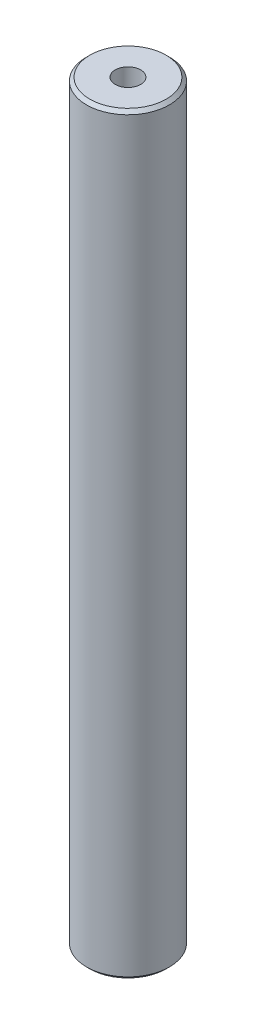
from build123d import *
from OCP.BRepFilletAPI import BRepFilletAPI_MakeChamfer

# Parameters (mm, degrees)
SKETCH1_R           = 32.5
BOSS_EXTRUDE1_DEPTH = 590.439226282
SKETCH2_R           = 9.954082652
CUT_EXTRUDE1_DEPTH  = 593.22544688
CHAMFER1_SIZE       = 2.584361648
CHAMFER1_SIZE2      = 2.582449988


with BuildPart() as part:
    # Sketch1 → Boss-Extrude1 (new body)
    with BuildSketch(Plane(origin=(0, 0, 0), x_dir=(1, 0, 0), z_dir=(0, 1, 0))):
        Circle(SKETCH1_R)
    extrude(amount=BOSS_EXTRUDE1_DEPTH)

    # Sketch2 → Cut-Extrude1 (cut, through all)
    with BuildSketch(Plane(origin=(0, 0, 0), x_dir=(1, 0, 0), z_dir=(0, 1, 0))):
        Circle(SKETCH2_R)
    extrude(amount=CUT_EXTRUDE1_DEPTH, mode=Mode.SUBTRACT)

    # Chamfer1: one chamfer whose edges measure the first distance from different faces: ONE call of the kernel's chamfer builder (chamfer() names one face for all edges)
    chamfer1_edges_1 = [part.edges().sort_by_distance(p)[0] for p in [
        (-32.5, 590.439226282, 0),
    ]]
    chamfer1_side_1 = [part.faces().sort_by_distance(p)[0] for p in [
        (-32.5, 295.219613141, 0),
    ]]
    chamfer1_edges_2 = [part.edges().sort_by_distance(p)[0] for p in [
        (-32.5, 0, 0),
    ]]
    chamfer1_side_2 = [part.faces().sort_by_distance(p)[0] for p in [
        (-31.580761184, 0, 0),
    ]]
    chamfer1 = BRepFilletAPI_MakeChamfer(part.part.solid().wrapped)
    for e in chamfer1_edges_1:
        chamfer1.Add(CHAMFER1_SIZE, CHAMFER1_SIZE2, e.wrapped, chamfer1_side_1[0].wrapped)  # the first distance lies on this face
    for e in chamfer1_edges_2:
        chamfer1.Add(CHAMFER1_SIZE, CHAMFER1_SIZE2, e.wrapped, chamfer1_side_2[0].wrapped)  # the first distance lies on this face
    add(Compound.cast(chamfer1.Shape()), mode=Mode.REPLACE)


solid = part.part
